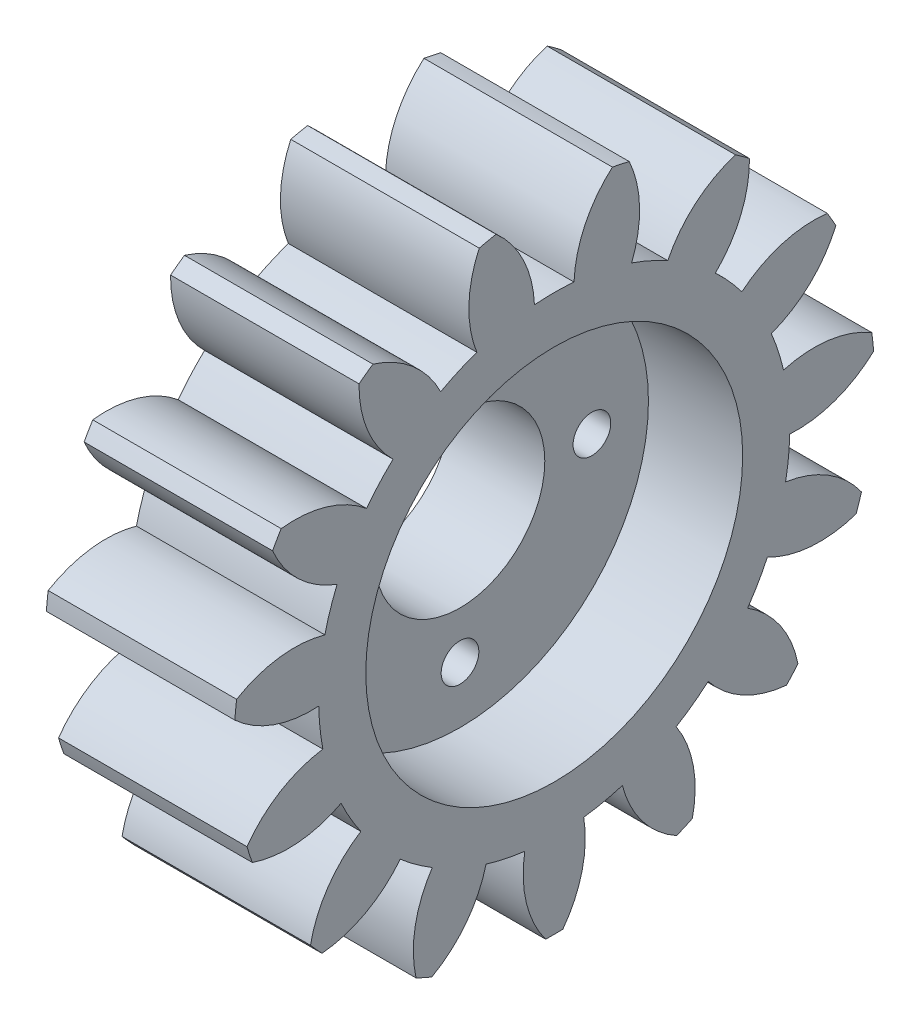
from build123d import *

# Parameters (mm, degrees)
BASPROSKE_W         = 10
BASPROSKE_H         = 17
TOOTHCUT_DEPTH      = 27.038433133
TEETHCUTS_COUNT     = 15
TEETHCUTS_ANGLE     = 336
BORSKE_R            = 10
BORE_DEPTH          = 50.0000508
BOSS_EXTRUDE1_START = 5
SKETCH1_R           = 10
SKETCH1_R_2         = 1
SKETCH1_R_3         = 4.5
BOSS_EXTRUDE1_DEPTH = 5


with BuildPart() as part:
    # BasProSke → Base-Revolve (revolve)
    with BuildSketch(Plane(origin=(0, 0, 0), x_dir=(1, 0, 0), z_dir=(0, 1, 0))):
        with Locations((5, 8.5)):
            Rectangle(BASPROSKE_W, BASPROSKE_H)
    revolve(axis=Axis((-10, 0, 0), (1, 0, 0)))

    # TooCutSke → ToothCut (cut, through all)
    with BuildSketch(Plane(origin=(0, 0, 0), x_dir=(0, 0, -1), z_dir=(1, 0, 0))):
        with BuildLine():
            ThreePointArc((1.050056448, 12.454813626), (0, 12.499), (-1.050056448, 12.454813626))
            ThreePointArc((-1.050056448, 12.454813626), (-1.638118106, 14.809604533), (-3.110934279, 16.73876737))
            ThreePointArc((-3.110934279, 16.73876737), (0, 17.0254), (3.110934279, 16.73876737))
            ThreePointArc((3.110934279, 16.73876737), (1.638118106, 14.809604533), (1.050056448, 12.454813626))
        make_face()
    toothcut = extrude(amount=TOOTHCUT_DEPTH, mode=Mode.SUBTRACT)

    # TeethCuts: ToothCut ×15 about axis
    teethcuts_axis = Axis((-10, 0, 0), (1, 0, 0))
    for i in range(1, TEETHCUTS_COUNT):
        add(toothcut.rotate(teethcuts_axis, i * TEETHCUTS_ANGLE / (TEETHCUTS_COUNT - 1)), mode=Mode.SUBTRACT)

    # BorSke → Bore (cut, symmetric)
    with BuildSketch(Plane(origin=(0, 0, 0), x_dir=(0, 0, -1), z_dir=(1, 0, 0))):
        Circle(BORSKE_R)
    extrude(amount=BORE_DEPTH, both=True, mode=Mode.SUBTRACT)

    # Sketch1 → Boss-Extrude1 (add)
    with BuildSketch(Plane(origin=(0, 0, 0), x_dir=(0, 0, -1), z_dir=(1, 0, 0)).offset(BOSS_EXTRUDE1_START)):
        Circle(SKETCH1_R)
        with Locations((7, 0)):
            Circle(SKETCH1_R_2, mode=Mode.SUBTRACT)
        with Locations((-7, 0)):
            Circle(SKETCH1_R_2, mode=Mode.SUBTRACT)
        with Locations((0, 7)):
            Circle(SKETCH1_R_2, mode=Mode.SUBTRACT)
        with Locations((0, -7)):
            Circle(SKETCH1_R_2, mode=Mode.SUBTRACT)
        Circle(SKETCH1_R_3, mode=Mode.SUBTRACT)
    extrude(amount=-BOSS_EXTRUDE1_DEPTH)


solid = part.part
